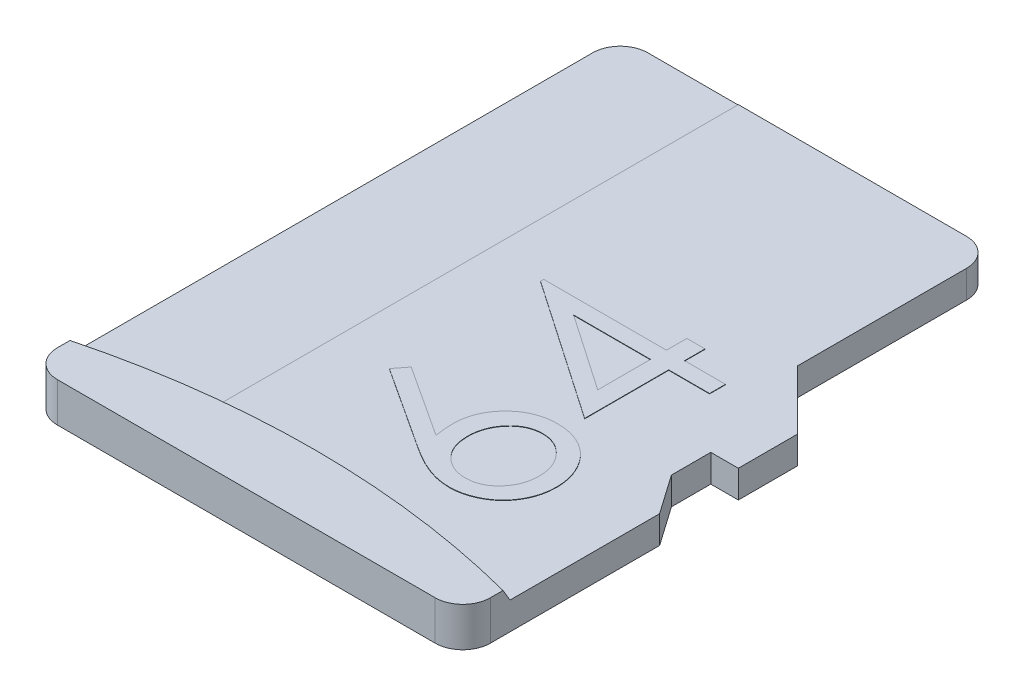
from build123d import *

# Parameters (mm, degrees)
BOSS_EXTRUDE1_DEPTH = 0.7
BOSS_EXTRUDE2_DEPTH = 0.3
FILLET1_R           = 0.7
CHAMFER1_SIZE2      = 0.3
CHAMFER1_SIZE       = 0.173205081
SKETCH3_W           = 0.8
SKETCH3_H           = 3
BOSS_EXTRUDE3_DEPTH = 0.01
LPATTERN1_COUNT     = 8
LPATTERN1_PITCH     = 1
CUT_EXTRUDE1_START  = -0.01
CUT_EXTRUDE1_DEPTH  = 0.01
BOSS_EXTRUDE4_DEPTH = 0.01


with BuildPart() as part:
    # Sketch1 → Boss-Extrude1 (new body)
    with BuildSketch(Plane(origin=(0, 0, 0), x_dir=(1, 0, 0), z_dir=(0, 1, 0))):
        Polygon((6, -2.5), (6, -7.5), (-5, -7.5), (-5, 7.5), (4.5, 7.5), (4.5, 2.5), (6, 1), (6, -0.5), (5.3, -0.5), (5.3, -1.5), align=None)
    extrude(amount=BOSS_EXTRUDE1_DEPTH)

    # Sketch2 → Boss-Extrude2 (add)
    with BuildSketch(Plane(origin=(0, 0.7, 0), x_dir=(1, 0, 0), z_dir=(0, 1, 0))):
        with BuildLine():
            Line((-5, -6.3), (-5, -7.5))
            Line((-5, -7.5), (6, -7.5))
            Line((6, -7.5), (6, -6.3))
            ThreePointArc((6, -6.3), (0.5, -5.6), (-5, -6.3))
        make_face()
    extrude(amount=BOSS_EXTRUDE2_DEPTH)

    # Fillet1
    fillet1_edges = [part.edges().sort_by_distance(p)[0] for p in [
        (6, 0.5, 7.5),
        (-5, 0.5, 7.5),
        (-5, 0.35, -7.5),
        (4.5, 0.35, -7.5),
    ]]
    fillet(fillet1_edges, radius=FILLET1_R)

    # Chamfer1
    chamfer1_edges = [part.edges().sort_by_distance(p)[0] for p in [
        (0.5, 1, 5.6),
    ]]
    chamfer1_side = [part.faces().sort_by_distance(p)[0] for p in [
        (0.5, 1, 5.603464102),
    ]]
    chamfer(chamfer1_edges, length=CHAMFER1_SIZE - 0.0001, length2=CHAMFER1_SIZE2 - 0.0001, reference=chamfer1_side[0])  # a hair under: the kernel refuses the full size

    # Sketch3 → Boss-Extrude3 (add)
    with BuildSketch(Plane.XZ):
        with Locations((-3.8, -5)):
            Rectangle(SKETCH3_W, SKETCH3_H)
    boss_extrude3 = extrude(amount=BOSS_EXTRUDE3_DEPTH)

    # LPattern1: Boss-Extrude3 ×8
    with Locations(*[(i * LPATTERN1_PITCH, 0, 0) for i in range(1, LPATTERN1_COUNT)]):
        add(boss_extrude3)

    # Sketch5 → Cut-Extrude1 (cut)
    with BuildSketch(Plane(origin=(0, 0.7, 0), x_dir=(1, 0, 0), z_dir=(0, 1, 0)).offset(CUT_EXTRUDE1_START)):
        with BuildLine():
            Line((-5, -6.3), (-5, 7.687555769))
            Line((-5, 7.687555769), (-2, 7.687555769))
            Line((-2, 7.687555769), (-2, -5.742786977))
            ThreePointArc((-2, -5.742786977), (-3.509690959, -5.969217972), (-5, -6.3))
        make_face()
    extrude(amount=CUT_EXTRUDE1_DEPTH, mode=Mode.SUBTRACT)

    # Sketch4 → Boss-Extrude4 (add)
    # profile 1 of 2: a face of its own
    with BuildSketch(Plane(origin=(0, 0.7, 0), x_dir=(1, 0, 0), z_dir=(0, 1, 0))):
        with BuildLine():
            Line((-0.615384615, -2.75), (-0.37109375, -2.439002404))
            Line((-0.37109375, -2.439002404), (1.447115385, -3.628004808))
            add(Edge.make_bspline(
                [(1.447115385, -3.628004808), (1.434497564, -3.548843023), (1.409885078, -3.394429011), (1.405824862, -3.238129999), (1.403846154, -3.161959135)],
                knots=[0, 0, 0, 0, 1.025318673, 2, 2, 2, 2], degree=3))
            add(Edge.make_bspline(
                [(1.403846154, -3.161959135), (1.40507544, -3.116223068), (1.407495254, -3.026192981), (1.426117348, -2.894012808), (1.455463919, -2.766998457), (1.498242541, -2.645676402), (1.552888396, -2.529611073), (1.618381342, -2.418136818), (1.698102499, -2.313347546), (1.787159106, -2.21389978), (1.885789037, -2.12359384), (1.990470293, -2.043703676), (2.101194596, -1.97622976), (2.217937047, -1.922472915), (2.339783801, -1.879511677), (2.46721007, -1.848928505), (2.600430921, -1.830645424), (2.691048417, -1.828176974), (2.737079327, -1.826923077)],
                knots=[0, 0, 0, 0, 1.043709831, 2.054511743, 3.041122595, 4.01515914, 4.98481438, 5.965901842, 6.960491961, 7.985277438, 9.0096037, 10.00832444, 10.987059228, 11.962929573, 12.936966118, 13.931840027, 14.949438142, 16, 16, 16, 16], degree=3))
            add(Edge.make_bspline(
                [(2.737079327, -1.826923077), (2.800055589, -1.828748336), (2.923977968, -1.832340015), (3.104428638, -1.868279847), (3.276237792, -1.923709962), (3.436432503, -2.004206562), (3.586122296, -2.102297304), (3.718320331, -2.223387248), (3.836219906, -2.361468581), (3.934767808, -2.517682681), (4.015260324, -2.685776222), (4.073072014, -2.862372856), (4.108665247, -3.045750298), (4.113127423, -3.170213408), (4.115384615, -3.233173077)],
                knots=[0, 0, 0, 0, 1.031403119, 2.029557249, 3.004870281, 3.983165322, 4.960181699, 5.929903783, 6.912123683, 7.928973898, 8.949315281, 9.960468141, 10.968302741, 12, 12, 12, 12], degree=3))
            add(Edge.make_bspline(
                [(4.115384615, -3.233173077), (4.113425363, -3.293728526), (4.109544427, -3.413678269), (4.074792271, -3.590083158), (4.018865585, -3.759886916), (3.940200981, -3.920909877), (3.842516001, -4.070320901), (3.725735923, -4.205059604), (3.589698509, -4.321514883), (3.437379658, -4.419302266), (3.273930698, -4.497189895), (3.103206109, -4.555053217), (2.925922629, -4.589030783), (2.805730368, -4.59376788), (2.745192308, -4.596153846)],
                knots=[0, 0, 0, 0, 1.012172929, 2.004937354, 2.995255351, 3.995689452, 4.993936421, 5.973737378, 6.968231049, 7.979117505, 8.993136101, 9.989812463, 10.987515067, 12, 12, 12, 12], degree=3))
            add(Edge.make_bspline(
                [(2.745192308, -4.596153846), (2.698849272, -4.594634845), (2.604225648, -4.591533336), (2.460914755, -4.569877549), (2.31427765, -4.535079955), (2.189879401, -4.496109639), (2.08797173, -4.454933854), (2.005810099, -4.420666303), (1.921260148, -4.378014023), (1.831422616, -4.332533961), (1.738612774, -4.280132273), (1.641279485, -4.223155009), (1.54097072, -4.160026886), (1.472899612, -4.115772392), (1.438100962, -4.093149038)],
                knots=[0, 0, 0, 0, 1.173818275, 2.396712641, 3.66331629, 4.989737886, 5.693666774, 6.447286557, 7.243889047, 8.091586357, 8.998013824, 9.943181721, 10.948533338, 12, 12, 12, 12], degree=3))
            Line((1.438100962, -4.093149038), (-0.615384615, -2.75))
        make_face()
        with BuildLine():
            add(Edge.make_bspline(
                [(1.865384615, -3.246694712), (1.8663753, -3.28097808), (1.868310394, -3.347943459), (1.879792233, -3.446134849), (1.900690488, -3.539368105), (1.929667741, -3.627670289), (1.965393302, -3.711586134), (2.011232334, -3.789452661), (2.064624344, -3.862872186), (2.125472743, -3.930671657), (2.192048636, -3.992157699), (2.263368863, -4.045103926), (2.337700822, -4.090775827), (2.415669188, -4.12790953), (2.497243218, -4.156825359), (2.582047978, -4.177741676), (2.670652083, -4.189382215), (2.73073673, -4.191318798), (2.761418269, -4.192307692)],
                knots=[0, 0, 0, 0, 1.129656352, 2.206547016, 3.251334079, 4.271920891, 5.265058649, 6.249872215, 7.241923875, 8.251504132, 9.246416584, 10.222533834, 11.173322129, 12.116503788, 13.062124155, 14.020151864, 14.989013135, 16, 16, 16, 16], degree=3))
            add(Edge.make_bspline(
                [(2.761418269, -4.192307692), (2.791820074, -4.191473852), (2.851730559, -4.189830668), (2.939673033, -4.175840608), (3.024108675, -4.153478957), (3.10472016, -4.121176044), (3.183055016, -4.08192157), (3.256667917, -4.031535431), (3.327943341, -3.973706783), (3.393569596, -3.906186554), (3.454494335, -3.833170458), (3.50796717, -3.755324944), (3.553183997, -3.673822107), (3.590651134, -3.588896682), (3.618232291, -3.499498881), (3.639347167, -3.4070803), (3.650890957, -3.3103844), (3.652848159, -3.244919557), (3.653846154, -3.211538462)],
                knots=[0, 0, 0, 0, 0.989367052, 1.949669134, 2.891858276, 3.827522767, 4.772653562, 5.738670152, 6.725809442, 7.756636004, 8.798867547, 9.819240912, 10.826537776, 11.829883227, 12.835515726, 13.868058748, 14.912904531, 16, 16, 16, 16], degree=3))
            add(Edge.make_bspline(
                [(3.653846154, -3.211538462), (3.652848082, -3.178157421), (3.650890727, -3.112692685), (3.639348041, -3.015996006), (3.618229086, -2.9235803), (3.590662748, -2.834172058), (3.553140653, -2.749285358), (3.508250138, -2.667853764), (3.454166469, -2.590744499), (3.393674202, -2.517680886), (3.32756834, -2.45044126), (3.257310144, -2.391252543), (3.182466, -2.342440577), (3.105028171, -2.301629691), (3.024060526, -2.269684452), (2.939686174, -2.247212711), (2.85172713, -2.233252413), (2.79181892, -2.231605144), (2.761418269, -2.230769231)],
                knots=[0, 0, 0, 0, 1.087281468, 2.132306021, 3.165025708, 4.170830268, 5.174347389, 6.181816599, 7.194310624, 8.23672049, 9.267723423, 10.261267456, 11.222032883, 12.171822355, 13.107646935, 14.049997283, 15.01046367, 16, 16, 16, 16], degree=3))
            add(Edge.make_bspline(
                [(2.761418269, -2.230769231), (2.730696704, -2.23147675), (2.670400261, -2.232865381), (2.582087612, -2.248571602), (2.496812336, -2.270354649), (2.415110442, -2.303247134), (2.337304096, -2.345979773), (2.263001203, -2.398030102), (2.191628428, -2.458242489), (2.125342463, -2.527800045), (2.064690312, -2.603502471), (2.011305764, -2.684058006), (1.965736495, -2.767997769), (1.929778734, -2.856504174), (1.900810753, -2.948386374), (1.879866743, -3.044278828), (1.868340324, -3.144249739), (1.866382401, -3.212111437), (1.865384615, -3.246694712)],
                knots=[0, 0, 0, 0, 0.978259475, 1.920005202, 2.851759169, 3.7803069, 4.719124913, 5.675758531, 6.668034766, 7.691045932, 8.733780038, 9.756656648, 10.768121246, 11.773215211, 12.79725739, 13.836288844, 14.897342417, 16, 16, 16, 16], degree=3))
        make_face(mode=Mode.SUBTRACT)
    # profile 2 of 2: a face of its own
    with BuildSketch(Plane(origin=(0, 0.7, 0), x_dir=(1, 0, 0), z_dir=(0, 1, 0))):
        Polygon((-0.615384615, 1.091045673), (-0.615384615, 1.173076923), (2.5, 1.173076923), (2.5, 1.692307692), (2.961538462, 1.692307692), (2.961538462, 1.173076923), (4, 1.173076923), (4, 0.769230769), (2.961538462, 0.769230769), (2.961538462, -1.365384615), align=None)
        Polygon((2.5, 0.769230769), (0.545673077, 0.769230769), (2.5, -0.572115385), align=None, mode=Mode.SUBTRACT)
    extrude(amount=BOSS_EXTRUDE4_DEPTH)


solid = part.part
